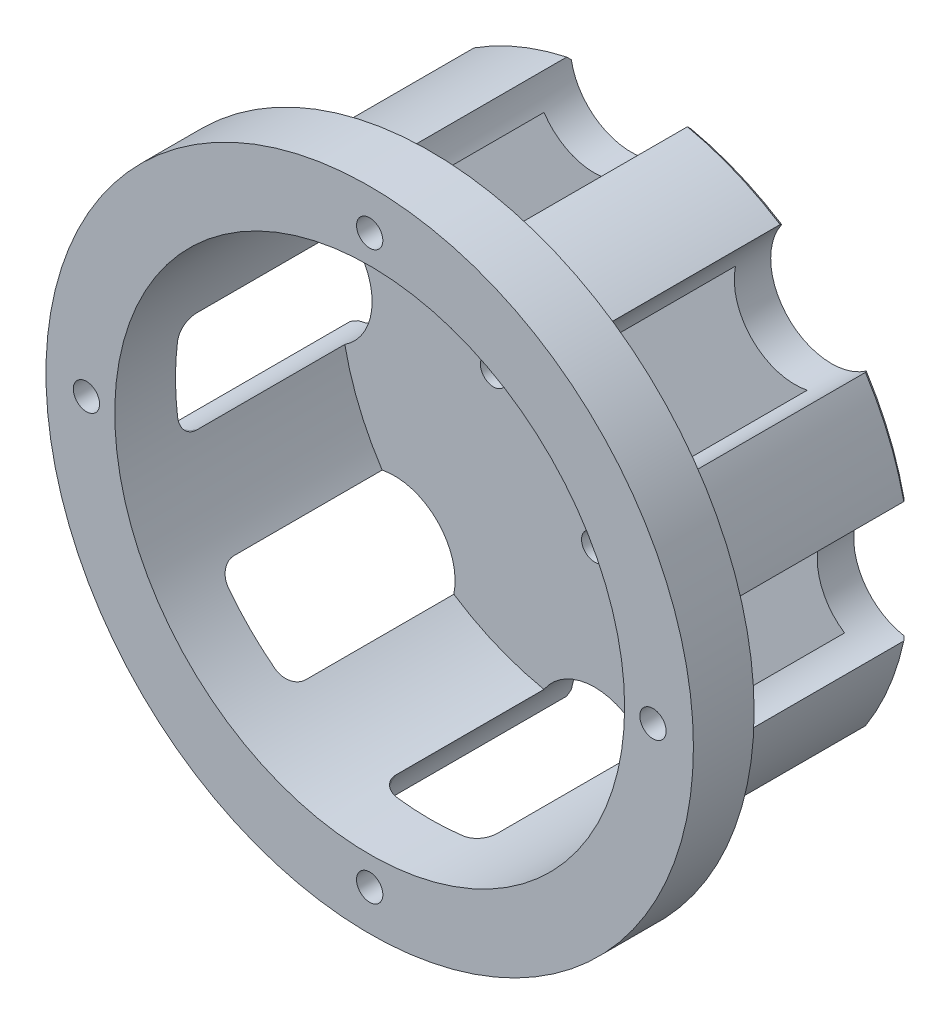
from build123d import *

# Parameters (mm, degrees)
SKETCH1_R           = 31.5
SKETCH1_R_2         = 1.625
SKETCH1_R_3         = 7
BOSS_EXTRUDE1_DEPTH = 4.5
SKETCH1_3_R         = 35
SKETCH1_3_R_2       = 31.5
BOSS_EXTRUDE2_DEPTH = 32.3
SKETCH2_R           = 7.5
CUT_EXTRUDE1_DEPTH  = 27.5
BOSS_EXTRUDE3_START = -7.5
SKETCH3_R           = 40
SKETCH3_R_2         = 31.5
BOSS_EXTRUDE3_DEPTH = 7.5
SKETCH4_R           = 1.625
CUT_EXTRUDE2_DEPTH  = 10
FILLET1_R           = 2
CHAMFER1_SIZE       = 0.5


with BuildPart() as part:
    # Sketch1 → Boss-Extrude1 (new body)
    with BuildSketch(Plane.XY):
        Circle(SKETCH1_R)
        with Locations((0, 12.5)):
            Circle(SKETCH1_R_2, mode=Mode.SUBTRACT)
        with Locations((-12.5, 0)):
            Circle(SKETCH1_R_2, mode=Mode.SUBTRACT)
        with Locations((0, -12.5)):
            Circle(SKETCH1_R_2, mode=Mode.SUBTRACT)
        with Locations((12.5, 0)):
            Circle(SKETCH1_R_2, mode=Mode.SUBTRACT)
        Circle(SKETCH1_R_3, mode=Mode.SUBTRACT)
    extrude(amount=BOSS_EXTRUDE1_DEPTH)

    # Sketch1<3> → Boss-Extrude2 (add)
    with BuildSketch(Plane.XY):
        Circle(SKETCH1_3_R)
        Circle(SKETCH1_3_R_2, mode=Mode.SUBTRACT)
    extrude(amount=BOSS_EXTRUDE2_DEPTH)

    # Sketch2 → Cut-Extrude1 (cut)
    with BuildSketch(Plane(origin=(0, 0, 0), x_dir=(-1, 0, 0), z_dir=(0, 0, -1))):
        with Locations((0, 35)):
            Circle(SKETCH2_R)
        with Locations((24.748737342, 24.748737342)):
            Circle(SKETCH2_R)
        with Locations((35, 0)):
            Circle(SKETCH2_R)
        with Locations((24.748737342, -24.748737342)):
            Circle(SKETCH2_R)
        with Locations((0, -35)):
            Circle(SKETCH2_R)
        with Locations((-24.748737342, -24.748737342)):
            Circle(SKETCH2_R)
        with Locations((-35, 0)):
            Circle(SKETCH2_R)
        with Locations((-24.748737342, 24.748737342)):
            Circle(SKETCH2_R)
    extrude(amount=-CUT_EXTRUDE1_DEPTH, mode=Mode.SUBTRACT)

    # Sketch3 → Boss-Extrude3 (add)
    with BuildSketch(Plane.XY.offset(32.3).offset(BOSS_EXTRUDE3_START)):
        Circle(SKETCH3_R)
        Circle(SKETCH3_R_2, mode=Mode.SUBTRACT)
    extrude(amount=BOSS_EXTRUDE3_DEPTH)

    # Sketch4 → Cut-Extrude2 (cut)
    with BuildSketch(Plane.XY.offset(32.3)):
        with Locations((0, 35)):
            Circle(SKETCH4_R)
        with Locations((35, 0)):
            Circle(SKETCH4_R)
        with Locations((0, -35)):
            Circle(SKETCH4_R)
        with Locations((-35, 0)):
            Circle(SKETCH4_R)
    extrude(amount=-CUT_EXTRUDE2_DEPTH, mode=Mode.SUBTRACT)

    # Fillet1
    fillet1_edges = [part.edges().sort_by_distance(p)[0] for p in [
        (-32.462524689, -7.057706359, 24.8),
        (27.945023368, 17.963919316, 24.8),
        (-27.945023368, 17.963919316, 24.8),
        (-7.057706359, 32.462524689, 24.8),
        (17.963919316, 27.945023368, 24.8),
        (32.462524689, -7.057706359, 24.8),
        (32.462524689, 7.057706359, 24.8),
        (-17.963919316, -27.945023368, 24.8),
        (7.057706359, -32.462524689, 24.8),
        (27.945023368, -17.963919316, 24.8),
        (17.963919316, -27.945023368, 24.8),
        (-7.057706359, -32.462524689, 24.8),
        (-27.945023368, -17.963919316, 24.8),
        (-32.462524689, 7.057706359, 24.8),
        (-17.963919316, 27.945023368, 24.8),
        (7.057706359, 32.462524689, 24.8),
        (13.393920133, 32.335783638, 24.8),
        (32.335783638, 13.393920133, 24.8),
        (32.335783638, -13.393920133, 24.8),
        (13.393920133, -32.335783638, 24.8),
        (-13.393920133, -32.335783638, 24.8),
        (-32.335783638, -13.393920133, 24.8),
        (-32.335783638, 13.393920133, 24.8),
        (-13.393920133, 32.335783638, 24.8),
    ]]
    fillet(fillet1_edges, radius=FILLET1_R)

    # Chamfer1
    chamfer1_edges = [part.edges().sort_by_distance(p)[0] for p in [
        (-32.335783638, -13.393920133, 0),
        (-13.393920133, -32.335783638, 0),
        (13.393920133, -32.335783638, 0),
        (32.335783638, -13.393920133, 0),
        (32.335783638, 13.393920133, 0),
        (13.393920133, 32.335783638, 0),
        (-13.393920133, 32.335783638, 0),
        (-32.335783638, 13.393920133, 0),
    ]]
    chamfer(chamfer1_edges, length=CHAMFER1_SIZE)


solid = part.part
